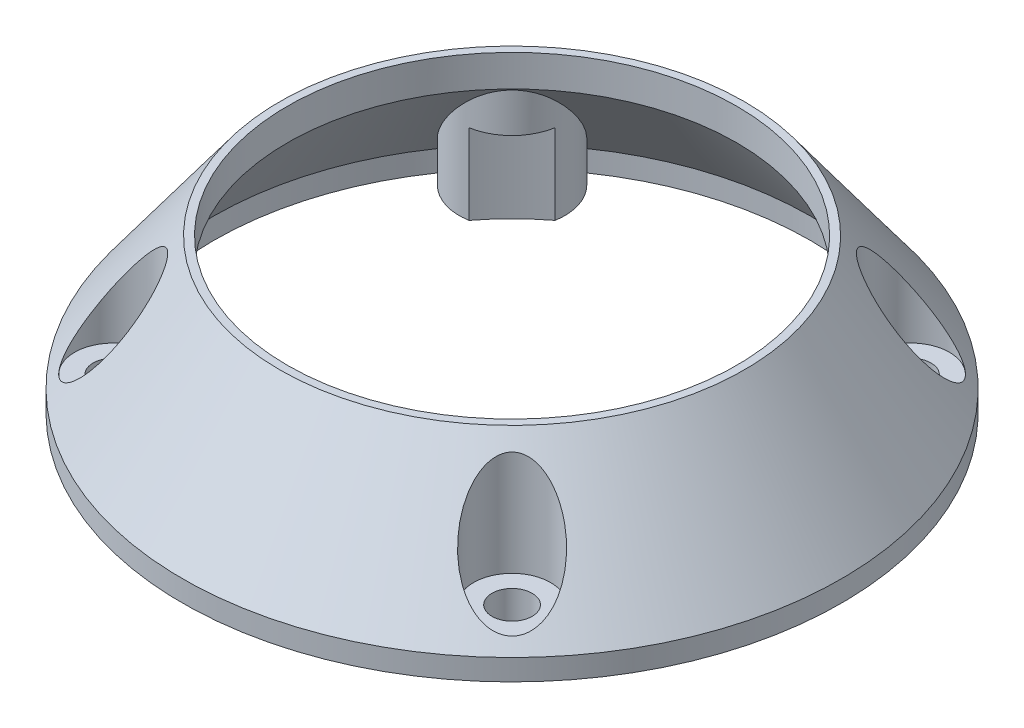
from build123d import *

# Parameters (mm, degrees)
BOSS_EXTRUDE2_REACH = 61.404
SKETCH6_R           = 2.413
CUT_EXTRUDE3_DEPTH  = 60.403601076
SKETCH7_R           = 4.6355
CUT_EXTRUDE6_DEPTH  = 15.723362
SKETCH8_R           = 51.318264322
CUT_EXTRUDE7_DEPTH  = 1.27
SKETCH9_R           = 28.575
CUT_EXTRUDE8_DEPTH  = 9.652


with BuildPart() as part:
    # Sketch3 → Revolve1 (revolve)
    with BuildSketch(Plane.XY):
        Polygon((35.89, 0), (27, 12.094590252), (27, 17.174590252), (39.624, 0), (39.624, -2.54), (35.89, -2.54), align=None)
    revolve(axis=Axis((0, -74.58294497, 0), (0, 1, 0)))

    # Boss-Extrude2: up to this cone (the profile starts inside it)
    boss_extrude2_end = Plane(origin=(0, -2.54, 0), z_dir=(0, -1, 0)).offset(-51.367315551) * Cone(1e-06, 111.011758661, 151.028315551, align=(Align.CENTER, Align.CENTER, Align.MIN), mode=Mode.PRIVATE)
    # Sketch4 → Boss-Extrude2 (add, up to the surface)
    with BuildSketch(Plane.XZ.offset(2.54), mode=Mode.PRIVATE) as boss_extrude2_sk1:
        with BuildLine():
            Line((-19.217748099, 28.19800422), (-20.487557981, 29.467814102))
            ThreePointArc((-20.487557981, 29.467814102), (-25.378062377, 25.378062377), (-29.467814102, 20.487557981))
            Line((-29.467814102, 20.487557981), (-28.19800422, 19.217748099))
            ThreePointArc((-28.19800422, 19.217748099), (-19.217748099, 19.217748099), (-19.217748099, 28.19800422))
        make_face()
    boss_extrude2_tool1 = extrude(boss_extrude2_sk1.sketch, amount=-BOSS_EXTRUDE2_REACH, mode=Mode.PRIVATE) & boss_extrude2_end
    add(boss_extrude2_tool1.solids().sort_by_distance((-22.615414, -2.54, 22.615414))[0])
    # Sketch4 → Boss-Extrude2 (add, up to the surface)
    with BuildSketch(Plane.XZ.offset(2.54), mode=Mode.PRIVATE) as boss_extrude2_sk2:
        with BuildLine():
            Line((28.19800422, 19.217748099), (29.467814102, 20.487557981))
            ThreePointArc((29.467814102, 20.487557981), (25.378062377, 25.378062377), (20.487557981, 29.467814102))
            Line((20.487557981, 29.467814102), (19.217748099, 28.19800422))
            ThreePointArc((19.217748099, 28.19800422), (19.217748099, 19.217748099), (28.19800422, 19.217748099))
        make_face()
    boss_extrude2_tool2 = extrude(boss_extrude2_sk2.sketch, amount=-BOSS_EXTRUDE2_REACH, mode=Mode.PRIVATE) & boss_extrude2_end
    add(boss_extrude2_tool2.solids().sort_by_distance((22.615414, -2.54, 22.615414))[0])
    # Sketch4 → Boss-Extrude2 (add, up to the surface)
    with BuildSketch(Plane.XZ.offset(2.54), mode=Mode.PRIVATE) as boss_extrude2_sk3:
        with BuildLine():
            Line((19.217748099, -28.19800422), (20.487557981, -29.467814102))
            ThreePointArc((20.487557981, -29.467814102), (25.378062377, -25.378062377), (29.467814102, -20.487557981))
            Line((29.467814102, -20.487557981), (28.19800422, -19.217748099))
            ThreePointArc((28.19800422, -19.217748099), (19.217748099, -19.217748099), (19.217748099, -28.19800422))
        make_face()
    boss_extrude2_tool3 = extrude(boss_extrude2_sk3.sketch, amount=-BOSS_EXTRUDE2_REACH, mode=Mode.PRIVATE) & boss_extrude2_end
    add(boss_extrude2_tool3.solids().sort_by_distance((22.615414, -2.54, -22.615414))[0])
    # Sketch4 → Boss-Extrude2 (add, up to the surface)
    with BuildSketch(Plane.XZ.offset(2.54), mode=Mode.PRIVATE) as boss_extrude2_sk4:
        with BuildLine():
            Line((-28.19800422, -19.217748099), (-29.467814102, -20.487557981))
            ThreePointArc((-29.467814102, -20.487557981), (-25.378062377, -25.378062377), (-20.487557981, -29.467814102))
            Line((-20.487557981, -29.467814102), (-19.217748099, -28.19800422))
            ThreePointArc((-19.217748099, -28.19800422), (-19.217748099, -19.217748099), (-28.19800422, -19.217748099))
        make_face()
    boss_extrude2_tool4 = extrude(boss_extrude2_sk4.sketch, amount=-BOSS_EXTRUDE2_REACH, mode=Mode.PRIVATE) & boss_extrude2_end
    add(boss_extrude2_tool4.solids().sort_by_distance((-22.615414, -2.54, -22.615414))[0])

    # Sketch6 → Cut-Extrude3 (cut, through all)
    with BuildSketch(Plane.XZ.offset(2.54)):
        with Locations((-23.977283843, 23.977283843)):
            Circle(SKETCH6_R)
        with Locations((23.977283843, 23.977283843)):
            Circle(SKETCH6_R)
        with Locations((23.977283843, -23.977283843)):
            Circle(SKETCH6_R)
        with Locations((-23.977283843, -23.977283843)):
            Circle(SKETCH6_R)
    extrude(amount=-CUT_EXTRUDE3_DEPTH, mode=Mode.SUBTRACT)

    # Sketch7 → Cut-Extrude6 (cut)
    with BuildSketch(Plane(origin=(0, 17.174590252, 0), x_dir=(1, 0, 0), z_dir=(0, 1, 0))):
        with Locations((-23.977283843, 23.977283843)):
            Circle(SKETCH7_R)
        with Locations((23.977283843, 23.977283843)):
            Circle(SKETCH7_R)
        with Locations((23.977283843, -23.977283843)):
            Circle(SKETCH7_R)
        with Locations((-23.977283843, -23.977283843)):
            Circle(SKETCH7_R)
    extrude(amount=-CUT_EXTRUDE6_DEPTH, mode=Mode.SUBTRACT)

    # Sketch8 → Cut-Extrude7 (cut)
    with BuildSketch(Plane(origin=(0, 17.174590252, 0), x_dir=(1, 0, 0), z_dir=(0, 1, 0))):
        Circle(SKETCH8_R)
    extrude(amount=-CUT_EXTRUDE7_DEPTH, mode=Mode.SUBTRACT)

    # Sketch9 → Cut-Extrude8 (cut)
    with BuildSketch(Plane(origin=(0, -2.54, 0), x_dir=(-1, 0, 0), z_dir=(0, -1, 0))):
        Circle(SKETCH9_R)
    extrude(amount=-CUT_EXTRUDE8_DEPTH, mode=Mode.SUBTRACT)


solid = part.part
